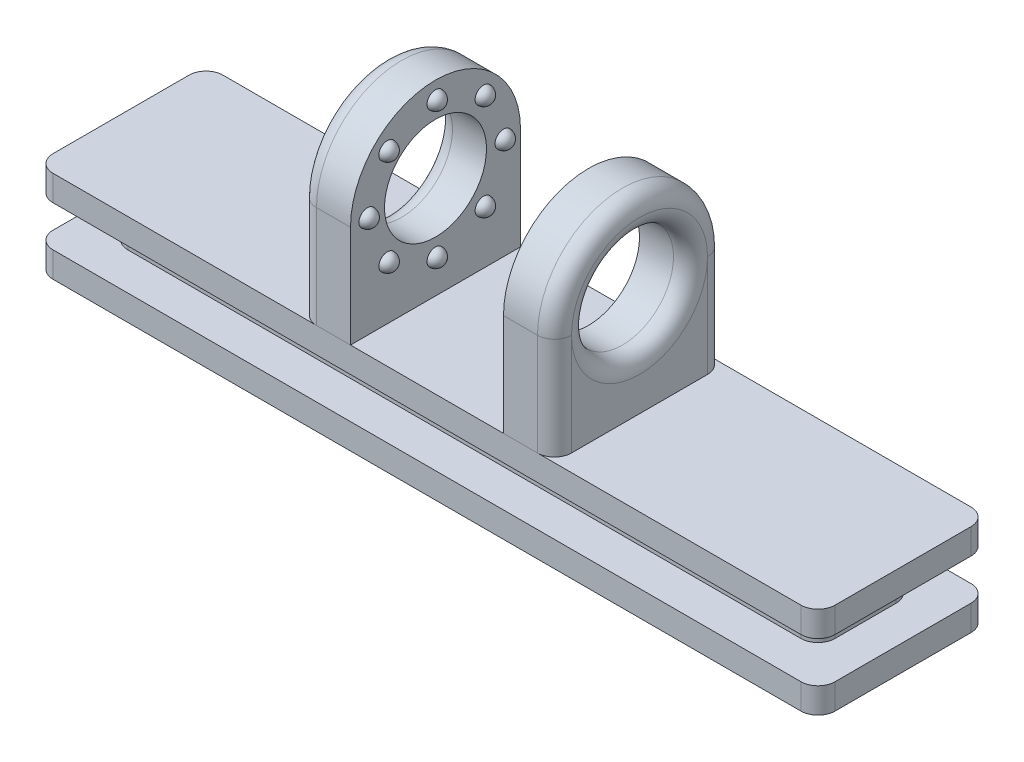
from build123d import *

# Parameters (mm, degrees)
SKETCH1_W           = 46
SKETCH1_H           = 10
BOSS_EXTRUDE1_DEPTH = 1.5
FILLET6_R           = 1
BOSS_EXTRUDE2_REACH = 36.377
SKETCH2_W           = 41.6
SKETCH2_H           = 5.6
BOSS_EXTRUDE4_DEPTH = 3
CUT_EXTRUDE1_START  = 4.5
SKETCH5_R           = 3
CUT_EXTRUDE1_DEPTH  = 3
CIRPATTERN1_COUNT   = 8
FILLET1_R           = 1
FILLET2_R           = 1
FILLET3_R           = 1
FILLET4_R           = 1
FILLET5_R           = 1


with BuildPart() as part:
    # Sketch1 → Boss-Extrude1 (new body)
    with BuildSketch(Plane(origin=(0, 0, 0), x_dir=(1, 0, 0), z_dir=(0, 1, 0))):
        with Locations((0, -20.249999594)):
            Rectangle(SKETCH1_W, SKETCH1_H)
    extrude(amount=BOSS_EXTRUDE1_DEPTH)

    # Fillet6
    fillet6_edges = [part.edges().sort_by_distance(p)[0] for p in [
        (23, 0.75, 25.249999594),
        (-23, 0.75, 25.249999594),
        (-23, 0.75, 15.249999594),
        (23, 0.75, 15.249999594),
    ]]
    fillet(fillet6_edges, radius=FILLET6_R)


with BuildPart() as body_2:
    # Mirror2: mirrored copy
    add(part.part.mirror(Plane.ZX.offset(-1.2)))

    # Sketch2 → Boss-Extrude2 (add, up to next)
    with BuildSketch(Plane(origin=(0, 0, 0), x_dir=(1, 0, 0), z_dir=(0, 1, 0)), mode=Mode.PRIVATE) as boss_extrude2_sk1:
        with Locations((0, -20.249999594)):
            Rectangle(SKETCH2_W, SKETCH2_H)
    boss_extrude2_tool1 = extrude(boss_extrude2_sk1.sketch, amount=-BOSS_EXTRUDE2_REACH, mode=Mode.PRIVATE) - body_2.part

    add(part.part)  # Boss-Extrude2 merges part
    add(boss_extrude2_tool1.solids().sort_by_distance((0, 0, 20.25))[0])

    # Fillet1
    fillet1_edges = [body_2.edges().sort_by_distance(p)[0] for p in [
        (-20.8, -1.2, 17.449999594),
        (20.8, -1.2, 17.449999594),
        (-20.8, -1.2, 23.049999594),
        (20.8, -1.2, 23.049999594),
    ]]
    fillet(fillet1_edges, radius=FILLET1_R)


with BuildPart() as body_2_2:
    # Sketch3 → Boss-Extrude4 (new body)
    with BuildSketch(Plane(origin=(4.5, 0, 0), x_dir=(0, 0, -1), z_dir=(1, 0, 0))):
        with BuildLine():
            Line((-25.249999594, 7.5), (-25.249999594, 1.5))
            Line((-25.249999594, 1.5), (-15.249999594, 1.5))
            Line((-15.249999594, 1.5), (-15.249999594, 7.5))
            ThreePointArc((-15.249999594, 7.5), (-20.249999594, 12.5), (-25.249999594, 7.5))
        make_face()
    extrude(amount=BOSS_EXTRUDE4_DEPTH)

    # Sketch5 → Cut-Extrude1 (cut)
    with BuildSketch(Plane(origin=(0, 0, 0), x_dir=(0, 0, -1), z_dir=(1, 0, 0)).offset(CUT_EXTRUDE1_START)):
        with Locations((-20.249999594, 7.5)):
            Circle(SKETCH5_R)
    extrude(amount=CUT_EXTRUDE1_DEPTH, mode=Mode.SUBTRACT)

    # Sketch4 → Revolve1 (revolve)
    with BuildSketch(Plane(origin=(4.5, 0, 0), x_dir=(0, 0, -1), z_dir=(1, 0, 0))):
        with BuildLine():
            Line((-20.249999594, 11.003422268), (-20.249999594, 12.003422268))
            ThreePointArc((-20.249999594, 12.003422268), (-19.749999594, 11.503422268), (-20.249999594, 11.003422268))
        make_face()
    revolve1 = revolve(axis=Axis((4.5, 6.41783205, 20.249999594), (0, 1, 0)))

    # CirPattern1: Revolve1 ×8 about axis
    cirpattern1_axis = Axis((0, 7.5, 20.249999594), (1, 0, 0))
    for i in range(1, CIRPATTERN1_COUNT):
        add(revolve1.rotate(cirpattern1_axis, i * 360 / CIRPATTERN1_COUNT))


with BuildPart() as body_3:
    # Mirror4: mirrored copy
    add(body_2_2.part.mirror(Plane(origin=(0, 0, 0), x_dir=(0, 0, 1), z_dir=(1, 0, 0))))

    # Fillet4
    fillet4_edges = [body_3.edges().sort_by_distance(p)[0] for p in [
        (-7.5, 4.5, 15.249999594),
        (-7.5, 12.5, 20.249999594),
        (-7.5, 4.5, 25.249999594),
    ]]
    fillet(fillet4_edges, radius=FILLET4_R)

    # Fillet5
    fillet5_edges = [body_3.edges().sort_by_distance(p)[0] for p in [
        (-7.5, 7.5, 23.249999594),
    ]]
    fillet(fillet5_edges, radius=FILLET5_R - 0.0001)  # a hair under: the kernel refuses the full size


with BuildPart() as body_2_2_1:
    add(body_2_2.part)

    # Fillet2
    fillet2_edges = [body_2_2_1.edges().sort_by_distance(p)[0] for p in [
        (7.5, 4.5, 15.249999594),
        (7.5, 12.5, 20.249999594),
        (7.5, 4.5, 25.249999594),
    ]]
    fillet(fillet2_edges, radius=FILLET2_R)

    # Fillet3
    fillet3_edges = [body_2_2_1.edges().sort_by_distance(p)[0] for p in [
        (7.5, 7.5, 23.249999594),
    ]]
    fillet(fillet3_edges, radius=FILLET3_R - 0.0001)  # a hair under: the kernel refuses the full size


solid = Compound([body_2.part, body_3.part, body_2_2_1.part])
